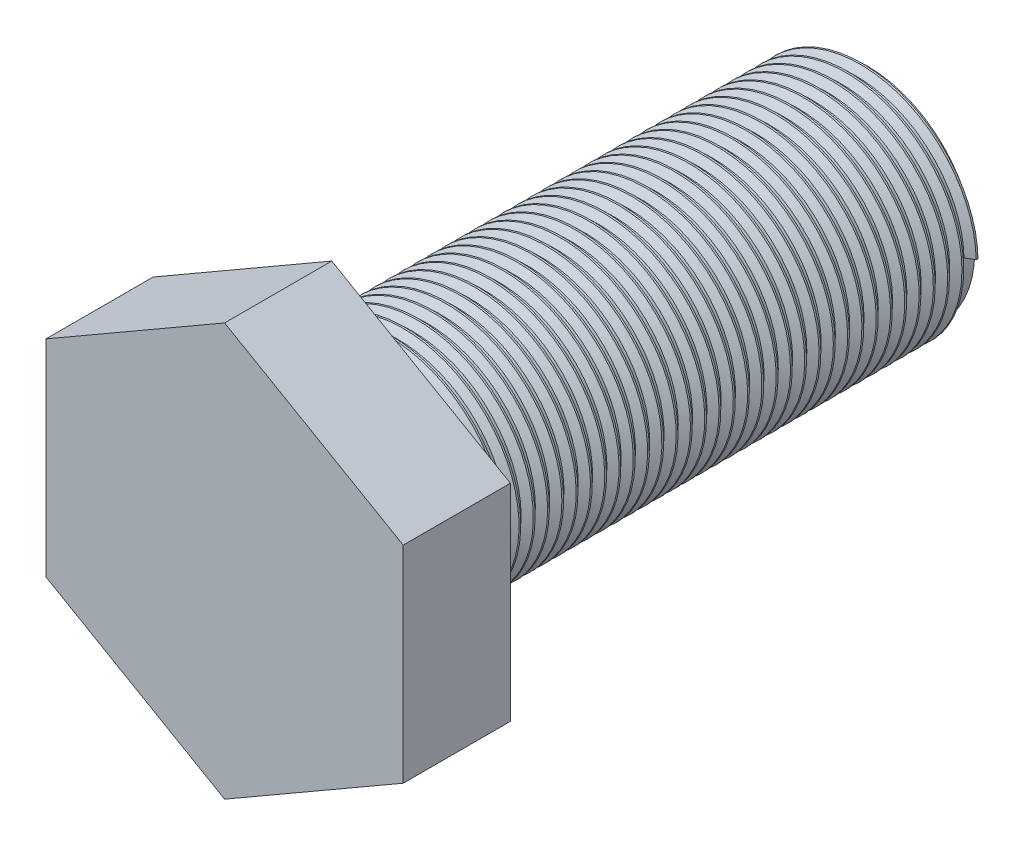
from build123d import *

# Parameters (mm, degrees)
CROQUIS1_R              = 3
SALIENTE_EXTRUIR1_DEPTH = 15
SALIENTE_EXTRUIR2_DEPTH = 3
ROSCA1_PITCH            = 0.4


with BuildPart() as part:
    # Croquis1 → Saliente-Extruir1 (new body)
    with BuildSketch(Plane.XY):
        Circle(CROQUIS1_R)
    extrude(amount=SALIENTE_EXTRUIR1_DEPTH)

    # Croquis2 → Saliente-Extruir2 (add)
    with BuildSketch(Plane.XY.offset(15)):
        Polygon((0, 5.773502692), (-5, 2.886751346), (-5, -2.886751346), (0, -5.773502692), (5, -2.886751346), (5, 2.886751346), align=None)
    extrude(amount=SALIENTE_EXTRUIR2_DEPTH)

    # Rosca1: the profile of Perfil de rosca1 profile screwed along a right-hand helix of 37.5 turns, 6 arcs to a turn; built about Z, then put on its axis
    rosca1_z = Axis((0, 0, 0), (0, 0, 1))
    rosca1_corners = [(2.9997, 0, -0.000173205), (3.21650635, 0, 0.124999999), (3.21650635, 0, 0.174999999), (2.9997, 0, 0.300173204)]
    with BuildLine(mode=Mode.PRIVATE) as rosca1_profile:
        Line(rosca1_corners[0], rosca1_corners[1])
        Line(rosca1_corners[1], rosca1_corners[2])
        Line(rosca1_corners[2], rosca1_corners[3])
        Line(rosca1_corners[3], rosca1_corners[0])
    rosca1_cap = Face(rosca1_profile.wire())
    rosca1_turn_angles = [0, 30, 60, 90, 120, 150, 180, 210, 240, 270, 300, 330, 360, 390, 420, 450, 480, 510, 540, 570, 600, 630, 660, 690, 720]
    rosca1_turn_weights = [1, 0.8660254037844387, 1, 0.8660254037844387, 1, 0.8660254037844387, 1, 0.8660254037844387, 1, 0.8660254037844387, 1, 0.8660254037844387, 1, 0.8660254037844387, 1, 0.8660254037844387, 1, 0.8660254037844387, 1, 0.8660254037844387, 1, 0.8660254037844387, 1, 0.8660254037844387, 1]
    rosca1_turn_rails = [Edge.make_bspline([Vector(p[0], p[1], 0).rotate(rosca1_z, rosca1_turn_angles[k]) / rosca1_turn_weights[k] + Vector(0, 0, p[2] + ROSCA1_PITCH * rosca1_turn_angles[k] / 360) for k in range(25)], [0, 0, 0, 1, 1, 2, 2, 3, 3, 4, 4, 5, 5, 6, 6, 7, 7, 8, 8, 9, 9, 10, 10, 11, 11, 12, 12, 12], 2, rosca1_turn_weights) for p in rosca1_corners]
    rosca1_turn_sides = [Face.make_surface_from_curves(rosca1_turn_rails[p[0]], rosca1_turn_rails[p[1]]) for p in [(0, 1), (1, 2), (2, 3), (3, 0)]]
    rosca1_last_angles = [12960, 12990, 13020, 13050, 13080, 13110, 13140, 13170, 13200, 13230, 13260, 13290, 13320, 13350, 13380, 13410, 13440, 13470, 13500]
    rosca1_last_weights = [1, 0.8660254037844387, 1, 0.8660254037844387, 1, 0.8660254037844387, 1, 0.8660254037844387, 1, 0.8660254037844387, 1, 0.8660254037844387, 1, 0.8660254037844387, 1, 0.8660254037844387, 1, 0.8660254037844387, 1]
    rosca1_last_rails = [Edge.make_bspline([Vector(p[0], p[1], 0).rotate(rosca1_z, rosca1_last_angles[k]) / rosca1_last_weights[k] + Vector(0, 0, p[2] + ROSCA1_PITCH * rosca1_last_angles[k] / 360) for k in range(19)], [0, 0, 0, 1, 1, 2, 2, 3, 3, 4, 4, 5, 5, 6, 6, 7, 7, 8, 8, 9, 9, 9], 2, rosca1_last_weights) for p in rosca1_corners]
    rosca1_last_sides = [Face.make_surface_from_curves(rosca1_last_rails[p[0]], rosca1_last_rails[p[1]]) for p in [(0, 1), (1, 2), (2, 3), (3, 0)]]
    rosca1 = Plane(origin=(0, 0, 0), x_dir=(1, 0, 0), z_dir=(0, 0, 1)) * Solid(Shell([*[p.moved(Location((0, 0, 2 * ROSCA1_PITCH * i))) for i in range(18) for p in rosca1_turn_sides], *rosca1_last_sides, rosca1_cap, rosca1_cap.rotate(rosca1_z, 13500).moved(Location((0, 0, ROSCA1_PITCH * 13500 / 360)))]))
    add(rosca1)


solid = part.part
